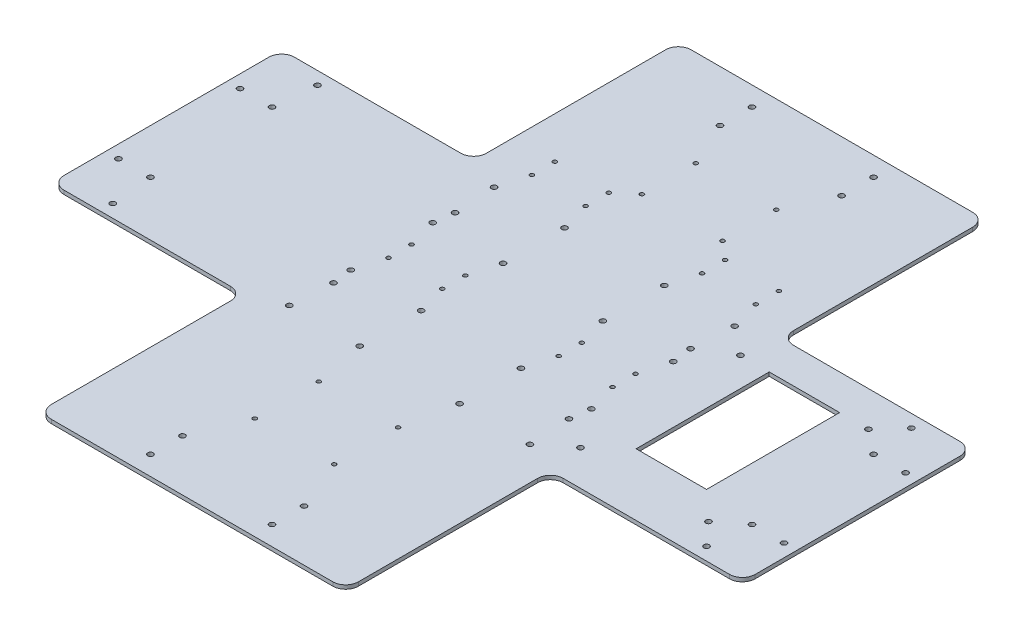
from build123d import *

# Parameters (mm, degrees)
BASE_DEPTH               = 3
FILLET1_R                = 10
SKETCH2_R                = 2.125
ARMOR_MODULE_HOLES_DEPTH = 3
SKETCH3_R                = 2.125
PLATES_FOR_GIMBAL_DEPTH  = 3
SKETCH6_R                = 2.125
SKETCH6_W                = 55
SKETCH6_H                = 104
BATTERY_MOUNT_DEPTH      = 10
SKETCH5_R                = 2.125
SUSPENSION_MOUNT_DEPTH   = 10
SKETCH7_R                = 2.125
OUTER_BOARD_MOUNT_DEPTH  = 10
SKETCH8_R                = 1.575
RFID_DEPTH               = 10
SKETCH9_R                = 1.575
PMM_DEPTH                = 10
SKETCH10_R               = 1.575
CUT_EXTRUDE2_DEPTH       = 10


with BuildPart() as part:
    # Sketch1 → Base (new body)
    with BuildSketch(Plane(origin=(0, 0, 0), x_dir=(1, 0, 0), z_dir=(0, 1, 0))):
        Polygon((120, 250), (-120, 250), (-120, 90), (-270, 90), (-270, -90), (-120, -90), (-120, -250), (120, -250), (120, -90), (270, -90), (270, 90), (120, 90), align=None)
    extrude(amount=BASE_DEPTH)

    # Fillet1
    fillet1_edges = [part.edges().sort_by_distance(p)[0] for p in [
        (120, 1.5, -90),
        (270, 1.5, -90),
        (270, 1.5, 90),
        (120, 1.5, 90),
        (120, 1.5, 250),
        (-120, 1.5, 250),
        (-120, 1.5, 90),
        (-270, 1.5, 90),
        (-270, 1.5, -90),
        (-120, 1.5, -90),
        (-120, 1.5, -250),
        (120, 1.5, -250),
    ]]
    fillet(fillet1_edges, radius=FILLET1_R)

    # Sketch2 → Armor Module Holes (cut)
    with BuildSketch(Plane(origin=(0, 3, 0), x_dir=(1, 0, 0), z_dir=(0, 1, 0))):
        with Locations((-47.5, 235)):
            Circle(SKETCH2_R)
        with Locations((-47.5, 210)):
            Circle(SKETCH2_R)
        with Locations((-260, 47.5)):
            Circle(SKETCH2_R)
        with Locations((-235, 47.5)):
            Circle(SKETCH2_R)
        with Locations((-235, -47.5)):
            Circle(SKETCH2_R)
        with Locations((-260, -47.5)):
            Circle(SKETCH2_R)
        with Locations((260, -47.5)):
            Circle(SKETCH2_R)
        with Locations((235, -47.5)):
            Circle(SKETCH2_R)
        with Locations((235, 47.5)):
            Circle(SKETCH2_R)
        with Locations((260, 47.5)):
            Circle(SKETCH2_R)
        with Locations((47.5, 210)):
            Circle(SKETCH2_R)
        with Locations((47.5, 235)):
            Circle(SKETCH2_R)
        with Locations((47.5, -235)):
            Circle(SKETCH2_R)
        with Locations((47.5, -210)):
            Circle(SKETCH2_R)
        with Locations((-47.5, -210)):
            Circle(SKETCH2_R)
        with Locations((-47.5, -235)):
            Circle(SKETCH2_R)
    extrude(amount=-ARMOR_MODULE_HOLES_DEPTH, mode=Mode.SUBTRACT)

    # Sketch3 → Plates for Gimbal (cut)
    with BuildSketch(Plane(origin=(0, 3, 0), x_dir=(1, 0, 0), z_dir=(0, 1, 0))):
        with Locations((92, 47.5)):
            Circle(SKETCH3_R)
        with Locations((92, -47.5)):
            Circle(SKETCH3_R)
        with Locations((-92, -47.5)):
            Circle(SKETCH3_R)
        with Locations((-92, 47.5)):
            Circle(SKETCH3_R)
    extrude(amount=-PLATES_FOR_GIMBAL_DEPTH, mode=Mode.SUBTRACT)

    # Sketch6 → Battery Mount (cut)
    with BuildSketch(Plane(origin=(0, 3, 0), x_dir=(1, 0, 0), z_dir=(0, 1, 0))):
        with Locations((116, -62.5)):
            Circle(SKETCH6_R)
        with Locations((216, -62.5)):
            Circle(SKETCH6_R)
        with Locations((216, 62.5)):
            Circle(SKETCH6_R)
        with Locations((116, 62.5)):
            Circle(SKETCH6_R)
        with Locations((166, 10.5)):
            Rectangle(SKETCH6_W, SKETCH6_H)
    extrude(amount=-BATTERY_MOUNT_DEPTH, mode=Mode.SUBTRACT)

    # Sketch5 → Suspension Mount (cut)
    with BuildSketch(Plane(origin=(0, 3, 0), x_dir=(1, 0, 0), z_dir=(0, 1, 0))):
        with Locations((94, -32)):
            Circle(SKETCH5_R)
        with Locations((94, -80)):
            Circle(SKETCH5_R)
        with Locations((39, -32)):
            Circle(SKETCH5_R)
        with Locations((39, -80)):
            Circle(SKETCH5_R)
        with Locations((-39, -80)):
            Circle(SKETCH5_R)
        with Locations((-39, -32)):
            Circle(SKETCH5_R)
        with Locations((-94, -80)):
            Circle(SKETCH5_R)
        with Locations((-94, -32)):
            Circle(SKETCH5_R)
        with Locations((-94, 32)):
            Circle(SKETCH5_R)
        with Locations((-94, 80)):
            Circle(SKETCH5_R)
        with Locations((-39, 32)):
            Circle(SKETCH5_R)
        with Locations((-39, 80)):
            Circle(SKETCH5_R)
        with Locations((39, 80)):
            Circle(SKETCH5_R)
        with Locations((39, 32)):
            Circle(SKETCH5_R)
        with Locations((94, 80)):
            Circle(SKETCH5_R)
        with Locations((94, 32)):
            Circle(SKETCH5_R)
    extrude(amount=-SUSPENSION_MOUNT_DEPTH, mode=Mode.SUBTRACT)

    # Sketch7 → Outer Board Mount (cut)
    with BuildSketch(Plane(origin=(0, 3, 0), x_dir=(1, 0, 0), z_dir=(0, 1, 0))):
        with Locations((-232, -80)):
            Circle(SKETCH7_R)
        with Locations((-232, 80)):
            Circle(SKETCH7_R)
        with Locations((232, 80)):
            Circle(SKETCH7_R)
        with Locations((232, -80)):
            Circle(SKETCH7_R)
    extrude(amount=-OUTER_BOARD_MOUNT_DEPTH, mode=Mode.SUBTRACT)

    # Sketch8 → RFID (cut)
    with BuildSketch(Plane(origin=(0, 3, 0), x_dir=(1, 0, 0), z_dir=(0, 1, 0))):
        with Locations((-31, -120)):
            Circle(SKETCH8_R)
        with Locations((-31, -170)):
            Circle(SKETCH8_R)
        with Locations((31, -170)):
            Circle(SKETCH8_R)
        with Locations((31, -120)):
            Circle(SKETCH8_R)
    extrude(amount=-RFID_DEPTH, mode=Mode.SUBTRACT)

    # Sketch9 → PMM (cut)
    with BuildSketch(Plane(origin=(0, 3, 0), x_dir=(1, 0, 0), z_dir=(0, 1, 0))):
        with Locations((-31.5, 175)):
            Circle(SKETCH9_R)
        with Locations((-31.5, 133)):
            Circle(SKETCH9_R)
        with Locations((31.5, 133)):
            Circle(SKETCH9_R)
        with Locations((31.5, 175)):
            Circle(SKETCH9_R)
    extrude(amount=-PMM_DEPTH, mode=Mode.SUBTRACT)

    # Sketch10 → Cut-Extrude2 (cut)
    with BuildSketch(Plane(origin=(0, 3, 0), x_dir=(1, 0, 0), z_dir=(0, 1, 0))):
        with Locations((-87.5, 9)):
            Circle(SKETCH10_R)
        with Locations((-45.5, 9)):
            Circle(SKETCH10_R)
        with Locations((-45.5, -9)):
            Circle(SKETCH10_R)
        with Locations((-87.5, -9)):
            Circle(SKETCH10_R)
        with Locations((87.5, -9)):
            Circle(SKETCH10_R)
        with Locations((45.5, -9)):
            Circle(SKETCH10_R)
        with Locations((45.5, 9)):
            Circle(SKETCH10_R)
        with Locations((87.5, 9)):
            Circle(SKETCH10_R)
        with Locations((87.5, 103)):
            Circle(SKETCH10_R)
        with Locations((45.5, 103)):
            Circle(SKETCH10_R)
        with Locations((45.5, 121)):
            Circle(SKETCH10_R)
        with Locations((87.5, 121)):
            Circle(SKETCH10_R)
        with Locations((-87.5, 121)):
            Circle(SKETCH10_R)
        with Locations((-45.5, 121)):
            Circle(SKETCH10_R)
        with Locations((-45.5, 103)):
            Circle(SKETCH10_R)
        with Locations((-87.5, 103)):
            Circle(SKETCH10_R)
    extrude(amount=-CUT_EXTRUDE2_DEPTH, mode=Mode.SUBTRACT)


solid = part.part
